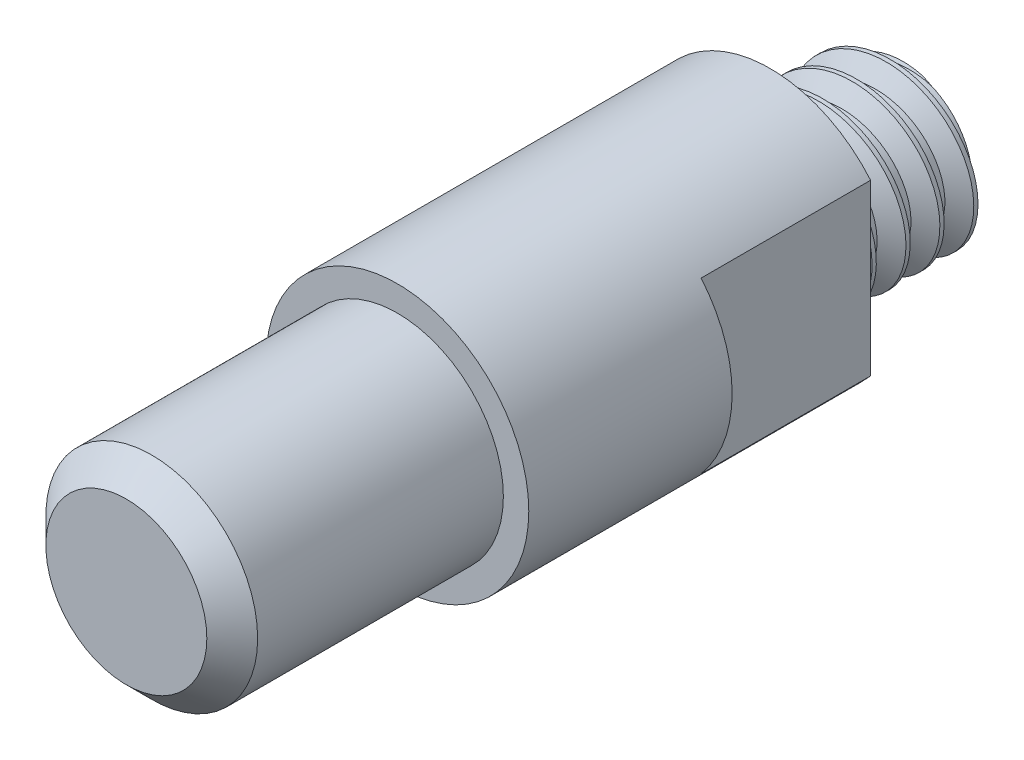
from build123d import *

# Parameters (mm, degrees)
SKETCH1_R           = 5
BOSS_EXTRUDE1_DEPTH = 8
THREAD1_PITCH       = 2
SKETCH4_OUTSIDE_W   = 49.89
SKETCH4_OUTSIDE_H   = 49.89
SKETCH4_OUTSIDE_R   = 4
CUT_EXTRUDE1_DEPTH  = 10
CUT_EXTRUDE1_DRAFT  = -60
SKETCH5_R           = 7.75
BOSS_EXTRUDE2_DEPTH = 22
SKETCH6_R           = 6.25
BOSS_EXTRUDE3_DEPTH = 16
CUT_EXTRUDE2_DEPTH  = 10
CHAMFER1_SIZE       = 1.5


with BuildPart() as part:
    # Sketch1 → Boss-Extrude1 (new body)
    with BuildSketch(Plane(origin=(0, 0, 0), x_dir=(0, 1, 0), z_dir=(0, 0, 1))):
        with Locations(Location((0, 0, 0), (0, 0, 270))):
            Circle(SKETCH1_R)
    extrude(amount=BOSS_EXTRUDE1_DEPTH)

    # Thread1: the profile of Thread Profile1 profile screwed along a right-hand helix of 6.5 turns, 10 arcs to a turn; built about Z, then put on its axis
    thread1_z = Axis((0, 0, 0), (0, 0, 1))
    thread1_corners = [(5.0003, 0, -0.000173205), (5.0003, 0, 1.7501732), (3.91746825, 0, 1.124999997), (3.91746825, 0, 0.624999997)]
    with BuildLine(mode=Mode.PRIVATE) as thread1_profile:
        Line(thread1_corners[0], thread1_corners[1])
        Line(thread1_corners[1], thread1_corners[2])
        Line(thread1_corners[2], thread1_corners[3])
        Line(thread1_corners[3], thread1_corners[0])
    thread1_cap = Face(thread1_profile.wire())
    thread1_turn_angles = [0, 18, 36, 54, 72, 90, 108, 126, 144, 162, 180, 198, 216, 234, 252, 270, 288, 306, 324, 342, 360]
    thread1_turn_weights = [1, 0.9510565162951535, 1, 0.9510565162951535, 1, 0.9510565162951535, 1, 0.9510565162951535, 1, 0.9510565162951535, 1, 0.9510565162951535, 1, 0.9510565162951535, 1, 0.9510565162951535, 1, 0.9510565162951535, 1, 0.9510565162951535, 1]
    thread1_turn_rails = [Edge.make_bspline([Vector(p[0], p[1], 0).rotate(thread1_z, thread1_turn_angles[k]) / thread1_turn_weights[k] + Vector(0, 0, p[2] + THREAD1_PITCH * thread1_turn_angles[k] / 360) for k in range(21)], [0, 0, 0, 1, 1, 2, 2, 3, 3, 4, 4, 5, 5, 6, 6, 7, 7, 8, 8, 9, 9, 10, 10, 10], 2, thread1_turn_weights) for p in thread1_corners]
    thread1_turn_sides = [Face.make_surface_from_curves(thread1_turn_rails[p[0]], thread1_turn_rails[p[1]]) for p in [(0, 1), (1, 2), (2, 3), (3, 0)]]
    thread1_last_angles = [2160, 2178, 2196, 2214, 2232, 2250, 2268, 2286, 2304, 2322, 2340]
    thread1_last_weights = [1, 0.9510565162951535, 1, 0.9510565162951535, 1, 0.9510565162951535, 1, 0.9510565162951535, 1, 0.9510565162951535, 1]
    thread1_last_rails = [Edge.make_bspline([Vector(p[0], p[1], 0).rotate(thread1_z, thread1_last_angles[k]) / thread1_last_weights[k] + Vector(0, 0, p[2] + THREAD1_PITCH * thread1_last_angles[k] / 360) for k in range(11)], [0, 0, 0, 1, 1, 2, 2, 3, 3, 4, 4, 5, 5, 5], 2, thread1_last_weights) for p in thread1_corners]
    thread1_last_sides = [Face.make_surface_from_curves(thread1_last_rails[p[0]], thread1_last_rails[p[1]]) for p in [(0, 1), (1, 2), (2, 3), (3, 0)]]
    thread1 = Plane(origin=(0, 0, -3), x_dir=(1, 0, 0), z_dir=(0, 0, 1)) * Solid(Shell([*[p.moved(Location((0, 0, THREAD1_PITCH * i))) for i in range(6) for p in thread1_turn_sides], *thread1_last_sides, thread1_cap, thread1_cap.rotate(thread1_z, 2340).moved(Location((0, 0, THREAD1_PITCH * 2340 / 360)))]))
    add(thread1, mode=Mode.SUBTRACT)


with BuildPart() as cut_extrude1_tool:
    # Sketch4 outside → Cut-Extrude1 (with draft: the straight prism first)
    with BuildSketch(Plane(origin=(0, 0, 0), x_dir=(1, 0, 0), z_dir=(0, 0, -1))):
        Rectangle(SKETCH4_OUTSIDE_W, SKETCH4_OUTSIDE_H)
        Circle(SKETCH4_OUTSIDE_R, mode=Mode.SUBTRACT)
    extrude(amount=-CUT_EXTRUDE1_DEPTH)
    # Cut-Extrude1: the draft: its side faces are tilted about the plane it starts from
    cut_extrude1_sides = [cut_extrude1_tool.faces().sort_by_distance(p)[0] for p in [
        (0, 24.945, 5),
        (24.945, 0, 5),
        (0, -24.945, 5),
        (-24.945, 0, 5),
        (-4, 0, 5),
    ]]
    draft(cut_extrude1_sides, Plane(origin=(0, 0, 0), x_dir=(1, 0, 0), z_dir=(0, 0, -1)), CUT_EXTRUDE1_DRAFT)


with BuildPart() as part_1:
    add(part.part)

    # Cut-Extrude1: cut by cut_extrude1_tool
    add(cut_extrude1_tool.part, mode=Mode.SUBTRACT)

    # Sketch5 → Boss-Extrude2 (add)
    with BuildSketch(Plane.XY.offset(8)):
        Circle(SKETCH5_R)
    extrude(amount=BOSS_EXTRUDE2_DEPTH)

    # Sketch6 → Boss-Extrude3 (add)
    with BuildSketch(Plane.XY.offset(30)):
        Circle(SKETCH6_R)
    extrude(amount=BOSS_EXTRUDE3_DEPTH)

    # Sketch7 → Cut-Extrude2 (cut)
    with BuildSketch(Plane(origin=(0, 0, 8), x_dir=(1, 0, 0), z_dir=(0, 0, -1))):
        with BuildLine():
            Line((-5.921359641, -5), (-5.921359641, 5))
            ThreePointArc((-5.921359641, 5), (-7.75, 0), (-5.921359641, -5))
        make_face()
        with BuildLine():
            Line((5.921359641, -5), (5.921359641, 5))
            ThreePointArc((5.921359641, 5), (7.75, 0), (5.921359641, -5))
        make_face()
    extrude(amount=-CUT_EXTRUDE2_DEPTH, mode=Mode.SUBTRACT)

    # Chamfer1
    chamfer1_edges = [part_1.edges().sort_by_distance(p)[0] for p in [
        (-6.25, 0, 46),
    ]]
    chamfer(chamfer1_edges, length=CHAMFER1_SIZE)


solid = part_1.part
